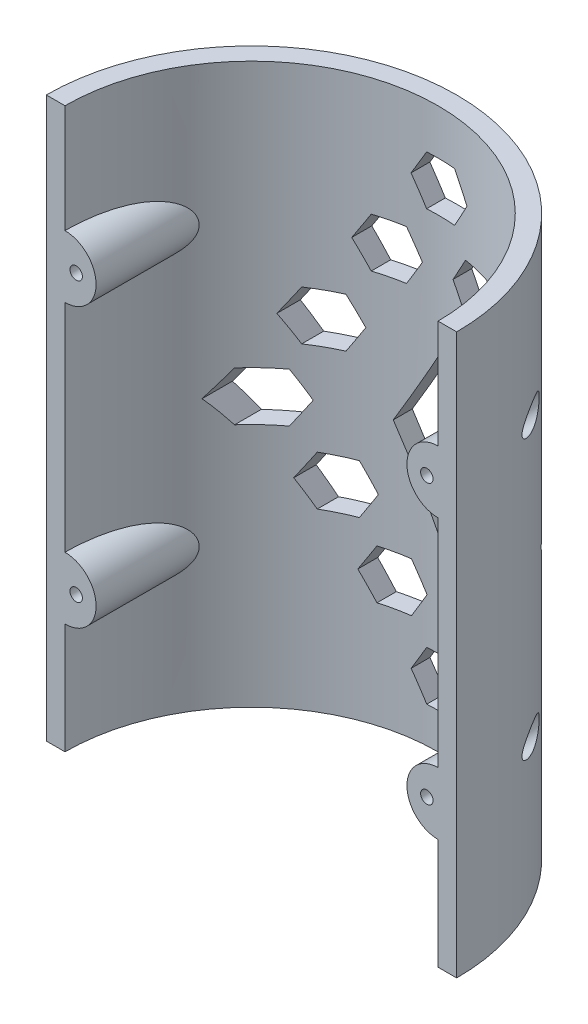
from build123d import *

# Parameters (mm, degrees)
BOSS_EXTRUDE1_DEPTH      = 90
BOSS_EXTRUDE3_REACH      = 103.38
BOSS_EXTRUDE3_END_RADIUS = 30
SKETCH8_R                = 1
CUT_EXTRUDE1_DEPTH       = 12
SKETCH9_R                = 2
CUT_EXTRUDE3_DEPTH       = 23
CUT_EXTRUDE11_DEPTH      = 102.380471646


with BuildPart() as part:
    # Sketch1 → Boss-Extrude1 (new body)
    with BuildSketch(Plane(origin=(0, 0, 0), x_dir=(1, 0, 0), z_dir=(0, 1, 0))):
        with BuildLine():
            Line((-30, 0), (-33, 0))
            ThreePointArc((-33, 0), (0, 33), (33, 0))
            Line((33, 0), (30, 0))
            ThreePointArc((30, 0), (0, 30), (-30, 0))
        make_face()
    boss_extrude1 = extrude(amount=BOSS_EXTRUDE1_DEPTH)

    # Boss-Extrude3: up to this cylinder (the profile starts inside it)
    boss_extrude3_end = Plane(origin=(0, 45.2, 0), z_dir=(0, -1, 0)) * Cylinder(BOSS_EXTRUDE3_END_RADIUS, 312.56, mode=Mode.PRIVATE)
    # Sketch7 → Boss-Extrude3 (add, up to the surface)
    with BuildSketch(Plane.XY, mode=Mode.PRIVATE) as boss_extrude3_sk1:
        with BuildLine():
            Line((-30, 62.6), (-30, 72.6))
            ThreePointArc((-30, 72.6), (-25, 67.6), (-30, 62.6))
        make_face()
    boss_extrude3_tool1 = extrude(boss_extrude3_sk1.sketch, amount=-BOSS_EXTRUDE3_REACH, mode=Mode.PRIVATE) & boss_extrude3_end
    # Sketch7 → Boss-Extrude3 (add, up to the surface)
    with BuildSketch(Plane.XY, mode=Mode.PRIVATE) as boss_extrude3_sk2:
        with BuildLine():
            Line((-30, 27.8), (-30, 17.8))
            ThreePointArc((-30, 17.8), (-25, 22.8), (-30, 27.8))
        make_face()
    boss_extrude3_tool2 = extrude(boss_extrude3_sk2.sketch, amount=-BOSS_EXTRUDE3_REACH, mode=Mode.PRIVATE) & boss_extrude3_end
    boss_extrude3 = boss_extrude3_tool1.solids().sort_by_distance((-27.877934, 67.6, 0))[0] + boss_extrude3_tool2.solids().sort_by_distance((-27.877934, 22.8, 0))[0]
    add(boss_extrude3)

    # Sketch8 → Cut-Extrude1 (cut)
    with BuildSketch(Plane.XY.offset(-2)):
        with Locations((-28.2, 67.6)):
            Circle(SKETCH8_R)
        with Locations((-28.2, 22.8)):
            Circle(SKETCH8_R)
    cut_extrude1 = extrude(amount=CUT_EXTRUDE1_DEPTH, mode=Mode.SUBTRACT)

    # Mirror3: Boss-Extrude1, Boss-Extrude3, Cut-Extrude1 across plane
    add(boss_extrude1.mirror(Plane(origin=(0, 0, 0), x_dir=(0, 0, 1), z_dir=(1, 0, 0))))
    add(boss_extrude3.mirror(Plane(origin=(0, 0, 0), x_dir=(0, 0, 1), z_dir=(1, 0, 0))))
    add(cut_extrude1.mirror(Plane(origin=(0, 0, 0), x_dir=(0, 0, 1), z_dir=(1, 0, 0))), mode=Mode.SUBTRACT)

    # Sketch9 → Cut-Extrude3 (cut)
    with BuildSketch(Plane.XY.offset(-2)):
        with Locations((-28.2, 67.6)):
            Circle(SKETCH9_R)
        with Locations((-28.2, 22.8)):
            Circle(SKETCH9_R)
    cut_extrude3 = extrude(amount=-CUT_EXTRUDE3_DEPTH, mode=Mode.SUBTRACT)

    # Mirror4: Cut-Extrude3 across plane
    add(cut_extrude3.mirror(Plane(origin=(0, 0, 0), x_dir=(0, 0, 1), z_dir=(1, 0, 0))), mode=Mode.SUBTRACT)

    # Sketch10 → Cut-Extrude11 (cut, through all)
    with BuildSketch(Plane.XY.offset(-33)):
        Polygon((2.794216899, 74.786799673), (5.082084087, 78.749501883), (2.794216899, 82.712204094), (-1.781517477, 82.712204094), (-4.069384665, 78.749501883), (-1.781517477, 74.786799673), align=None)
        Polygon((16.079312973, 52.126781648), (18.367180161, 56.089483858), (16.079312973, 60.052186069), (11.503578598, 60.052186069), (9.21571141, 56.089483858), (11.503578598, 52.126781648), align=None)
        Polygon((22.444306256, 40.831445264), (24.732173444, 44.794147475), (22.444306256, 48.756849685), (17.86857188, 48.756849685), (15.580704692, 44.794147475), (17.86857188, 40.831445264), align=None)
        Polygon((9.383010211, 63.161534088), (11.670877398, 67.124236298), (9.383010211, 71.086938509), (4.807275835, 71.086938509), (2.519408647, 67.124236298), (4.807275835, 63.161534088), align=None)
        Polygon((16.079312973, 28.625273389), (18.367180161, 32.587975599), (16.079312973, 36.55067781), (11.503578597, 36.55067781), (9.21571141, 32.587975599), (11.503578597, 28.625273389), align=None)
        Polygon((9.865498233, 17.37323048), (12.153365421, 21.33593269), (9.865498233, 25.298634901), (5.289763857, 25.298634901), (3.001896669, 21.33593269), (5.289763857, 17.37323048), align=None)
        Polygon((2.811978797, 5.785305693), (5.099845985, 9.748007903), (2.811978797, 13.710710114), (-1.763755579, 13.710710114), (-4.051622767, 9.748007903), (-1.763755579, 5.785305693), align=None)
        Polygon((-4.001740899, 17.097403441), (-1.713873711, 21.060105652), (-4.001740899, 25.022807862), (-8.577475275, 25.022807862), (-10.865342463, 21.060105652), (-8.577475275, 17.097403441), align=None)
        Polygon((-10.683155359, 28.277195952), (-8.395288171, 32.239898163), (-10.683155359, 36.202600373), (-15.258889734, 36.202600373), (-17.546756922, 32.239898163), (-15.258889734, 28.277195952), align=None)
        Polygon((-17.953381044, 39.388295585), (-15.665513856, 43.350997795), (-17.953381044, 47.313700006), (-22.52911542, 47.313700006), (-24.816982608, 43.350997795), (-22.52911542, 39.388295585), align=None)
        Polygon((-12.215115367, 51.001452312), (-9.927248179, 54.964154522), (-12.215115367, 58.926856733), (-16.790849743, 58.926856733), (-19.078716931, 54.964154522), (-16.790849743, 51.001452312), align=None)
        Polygon((-4.700719838, 63.069028123), (-2.41285265, 67.031730333), (-4.700719838, 70.994432544), (-9.276454214, 70.994432544), (-11.564321402, 67.031730333), (-9.276454214, 63.069028123), align=None)
        Polygon((0.062242473, 30.350712555), (7.325889432, 43.40894561), (0.771192374, 56.409230851), (-6.492454585, 43.350997795), align=None)
    extrude(amount=CUT_EXTRUDE11_DEPTH, mode=Mode.SUBTRACT)


solid = part.part
